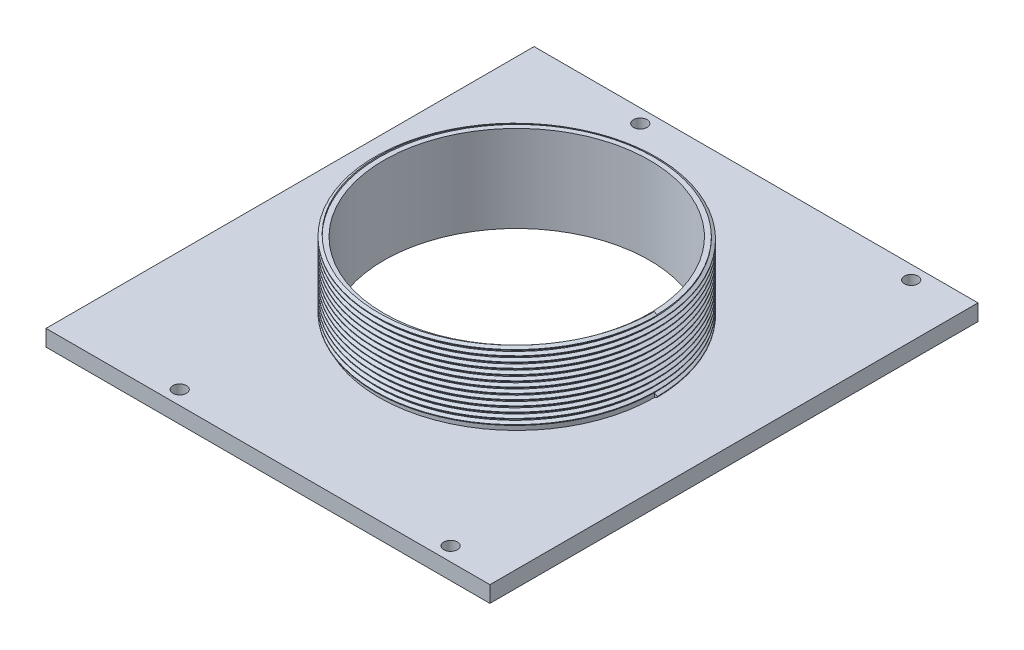
from build123d import *
from build123d.topology import SkipClean

# Parameters (mm, degrees)
SKETCH_1_W          = 81.927067394
SKETCH_1_H          = 90.075715262
EXTRUDE_2_DEPTH     = 3
HOLE_WIZARD_M3_1_D  = 2.5
SKETCH_13_R         = 24.5
CUT_EXTRUDE_1_DEPTH = 5
SKETCH_14_R         = 25.4
EXTRUDE_3_DEPTH     = 13
CUT_EXTRUDE_2_REACH = 260.085
SKETCH_15_R         = 24.5
THREAD_1_PITCH      = 1


with BuildPart() as part:
    # Sketch 1 → 凸台-拉伸2 (new body)
    with BuildSketch(Plane(origin=(0, 262.230227316, 0), x_dir=(1, 0, 0), z_dir=(0, 1, 0))):
        with Locations((195.807111287, -56.409431979)):
            Rectangle(SKETCH_1_W, SKETCH_1_H)
    extrude(amount=-EXTRUDE_2_DEPTH)

    # M3 螺纹孔的螺纹孔钻头1 (through all)
    with Locations(Plane(origin=(0, 262.230227316, 0), x_dir=(1, 0, 0), z_dir=(0, 1, 0))):
        with Locations((176.94357759, -13.871574348), (226.94357759, -13.871574348), (226.94357759, -98.871574348), (176.94357759, -98.871574348)):
            Hole(HOLE_WIZARD_M3_1_D / 2)

    # 草图13 → 切除-拉伸1 (cut, symmetric)
    with BuildSketch(Plane(origin=(0, 262.230227316, 0), x_dir=(1, 0, 0), z_dir=(0, 1, 0))):
        with Locations(Location((196.64357759, -56.371574348, 0), (0, 0, 270))):
            Circle(SKETCH_13_R)
    extrude(amount=CUT_EXTRUDE_1_DEPTH, both=True, mode=Mode.SUBTRACT)

    # 草图14 → 凸台-拉伸3 (add)
    with BuildSketch(Plane(origin=(0, 262.230227316, 0), x_dir=(1, 0, 0), z_dir=(0, 1, 0))):
        with Locations(Location((196.64357759, -56.371574348, 0), (0, 0, 90))):
            Circle(SKETCH_14_R)
    extrude(amount=EXTRUDE_3_DEPTH)

    # 草图15 → 切除-拉伸2 (cut, up to next)
    with BuildSketch(Plane(origin=(0, 275.230227316, 0), x_dir=(1, 0, 0), z_dir=(0, 1, 0)), mode=Mode.PRIVATE) as cut_extrude_2_sk1:
        with Locations(Location((196.64357759, -56.371574348, 0), (0, 0, 270))):
            Circle(SKETCH_15_R)
    cut_extrude_2_tool1 = extrude(cut_extrude_2_sk1.sketch, amount=-CUT_EXTRUDE_2_REACH, mode=Mode.PRIVATE) & part.part
    add(cut_extrude_2_tool1.solids().sort_by_distance((196.643578, 275.230227, 56.371574))[0], mode=Mode.SUBTRACT)

    # 螺纹线1: the profile of Sketch 1 2 profile screwed along a right-hand helix of 13 turns, 8 arcs to a turn; built about Z, then put on its axis
    with SkipClean():  # the faces are left unmerged after this step: merging them gives an invalid solid
        thread_1_z = Axis((0, 0, 0), (0, 0, 1))
        thread_1_corners = [(25.3997, 0, -0.000173205), (25.941265875, 0, 0.312499999), (25.941265875, 0, 0.437499999), (25.3997, 0, 0.750173202)]
        with BuildLine(mode=Mode.PRIVATE) as thread_1_profile:
            Line(thread_1_corners[0], thread_1_corners[1])
            Line(thread_1_corners[1], thread_1_corners[2])
            Line(thread_1_corners[2], thread_1_corners[3])
            Line(thread_1_corners[3], thread_1_corners[0])
        thread_1_cap = Face(thread_1_profile.wire())
        thread_1_turn_angles = [0, 22.5, 45, 67.5, 90, 112.5, 135, 157.5, 180, 202.5, 225, 247.5, 270, 292.5, 315, 337.5, 360]
        thread_1_turn_weights = [1, 0.9238795325112867, 1, 0.9238795325112867, 1, 0.9238795325112867, 1, 0.9238795325112867, 1, 0.9238795325112867, 1, 0.9238795325112867, 1, 0.9238795325112867, 1, 0.9238795325112867, 1]
        thread_1_turn_rails = [Edge.make_bspline([Vector(p[0], p[1], 0).rotate(thread_1_z, thread_1_turn_angles[k]) / thread_1_turn_weights[k] + Vector(0, 0, p[2] + THREAD_1_PITCH * thread_1_turn_angles[k] / 360) for k in range(17)], [0, 0, 0, 1, 1, 2, 2, 3, 3, 4, 4, 5, 5, 6, 6, 7, 7, 8, 8, 8], 2, thread_1_turn_weights) for p in thread_1_corners]
        thread_1_turn_sides = [Face.make_surface_from_curves(thread_1_turn_rails[p[0]], thread_1_turn_rails[p[1]]) for p in [(0, 1), (1, 2), (2, 3), (3, 0)]]
        thread_1 = Plane(origin=(196.64357759, 262.230227316, 56.371574348), x_dir=(1, 0, 0), z_dir=(0, 1, 0)) * Solid(Shell([*[p.moved(Location((0, 0, THREAD_1_PITCH * i))) for i in range(13) for p in thread_1_turn_sides], thread_1_cap, thread_1_cap.rotate(thread_1_z, 4680).moved(Location((0, 0, THREAD_1_PITCH * 4680 / 360)))]))
        add(thread_1)


solid = part.part
